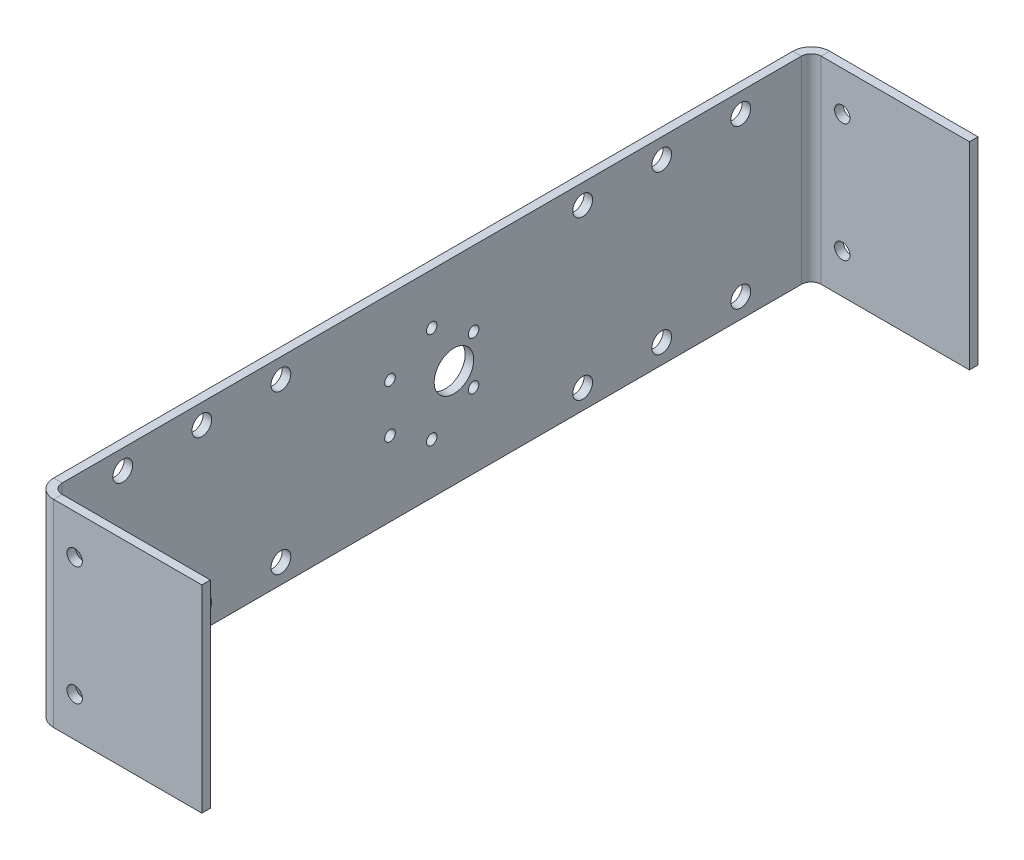
from build123d import *

# Parameters (mm, degrees)
BASE_FLANGE1_DEPTH = 63.5
SKETCH8_R          = 2.4638
CUT_EXTRUDE2_DEPTH = 263.252824078
SKETCH9_R          = 3.175
CUT_EXTRUDE3_DEPTH = 6.35
SKETCH10_R         = 6.35
SKETCH10_R_2       = 1.7
CUT_EXTRUDE4_DEPTH = 6.35


# Sheet-metal steps are written as plain solids
with BuildPart() as part:
    # Sketch1 → Base-Flange1 (new body)
    with BuildSketch(Plane(origin=(0, 0, 0), x_dir=(1, 0, 0), z_dir=(0, 1, 0))):
        with BuildLine():
            Line((50.8, 0), (3.175, 0))
            ThreePointArc((3.175, 0), (0.92993597, 0.92993597), (0, 3.175))
            Line((0, 3.175), (0, 240.665))
            ThreePointArc((0, 240.665), (0.92993597, 242.91006403), (3.175, 243.84))
            Line((3.175, 243.84), (50.8, 243.84))
            Line((50.8, 243.84), (50.8, 246.5832))
            Line((50.8, 246.5832), (3.175, 246.5832))
            ThreePointArc((3.175, 246.5832), (-1.009799352, 244.849799352), (-2.7432, 240.665))
            Line((-2.7432, 240.665), (-2.7432, 3.175))
            ThreePointArc((-2.7432, 3.175), (-1.009799352, -1.009799352), (3.175, -2.7432))
            Line((3.175, -2.7432), (50.8, -2.7432))
            Line((50.8, -2.7432), (50.8, 0))
        make_face()
    extrude(amount=BASE_FLANGE1_DEPTH)

    # Sketch8 → Cut-Extrude2 (cut, through all)
    with BuildSketch(Plane(origin=(0, 0, -246.5832), x_dir=(-1, 0, 0), z_dir=(0, 0, -1))):
        with Locations((-9.9568, 12.7)):
            Circle(SKETCH8_R)
        with Locations((-9.9568, 50.8)):
            Circle(SKETCH8_R)
    extrude(amount=-CUT_EXTRUDE2_DEPTH, mode=Mode.SUBTRACT)

    # Sketch9 → Cut-Extrude3 (cut)
    with BuildSketch(Plane(origin=(0, 0, 0), x_dir=(0, 0, -1), z_dir=(1, 0, 0))):
        with Locations((221.1832, 6.35)):
            Circle(SKETCH9_R)
        with Locations((195.7832, 6.35)):
            Circle(SKETCH9_R)
        with Locations((170.3832, 6.35)):
            Circle(SKETCH9_R)
        with Locations((48.0568, 6.35)):
            Circle(SKETCH9_R)
        with Locations((22.6568, 6.35)):
            Circle(SKETCH9_R)
        with Locations((73.4568, 6.35)):
            Circle(SKETCH9_R)
    cut_extrude3 = extrude(amount=-CUT_EXTRUDE3_DEPTH, mode=Mode.SUBTRACT)

    # Mirror1: Cut-Extrude3 across plane
    add(cut_extrude3.mirror(Plane.ZX.offset(31.75)), mode=Mode.SUBTRACT)

    # Sketch10 → Cut-Extrude4 (cut)
    with BuildSketch(Plane.ZY.offset(2.7432)):
        with Locations((-129.032, 31.75)):
            Circle(SKETCH10_R)
        with Locations((-121.92, 16.256)):
            Circle(SKETCH10_R_2)
        with Locations((-135.338197606, 24.003)):
            Circle(SKETCH10_R_2)
        with Locations((-135.338197606, 39.497)):
            Circle(SKETCH10_R_2)
        with Locations((-121.92, 47.244)):
            Circle(SKETCH10_R_2)
        with Locations((-108.501802394, 39.497)):
            Circle(SKETCH10_R_2)
        with Locations((-108.501802394, 24.003)):
            Circle(SKETCH10_R_2)
    extrude(amount=-CUT_EXTRUDE4_DEPTH, mode=Mode.SUBTRACT)


solid = part.part
